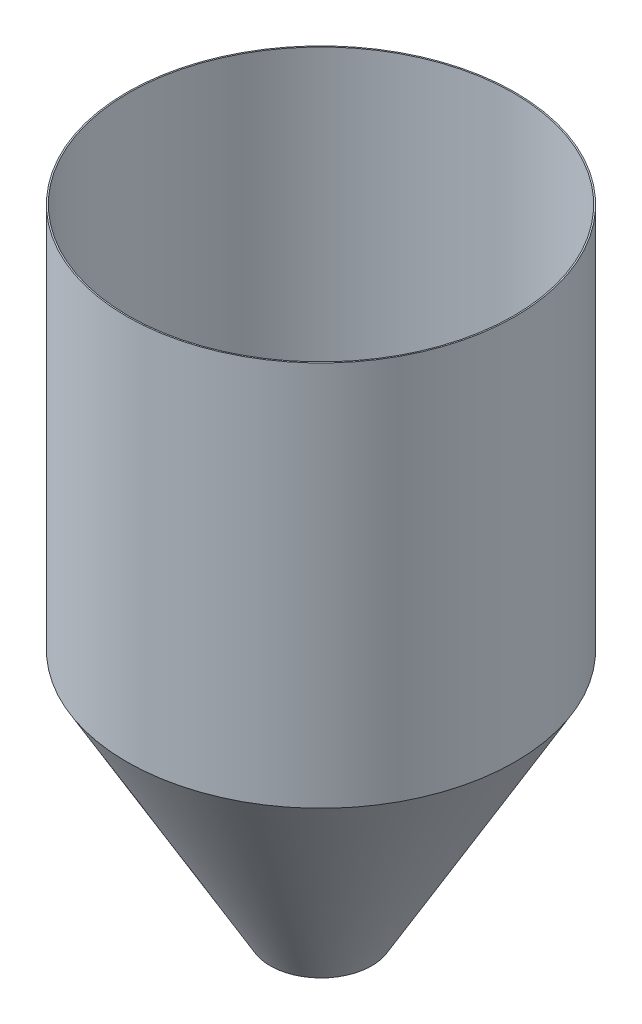
from build123d import *

# Parameters (mm, degrees)
SKETCH7_R           = 230.1875
SKETCH7_R_2         = 228.6
BOSS_EXTRUDE1_DEPTH = 457.2


with BuildPart() as part:
    # Sketch7 → Boss-Extrude1 (new body)
    with BuildSketch(Plane(origin=(0, 0, 0), x_dir=(1, 0, 0), z_dir=(0, 1, 0))):
        Circle(SKETCH7_R)
        Circle(SKETCH7_R_2, mode=Mode.SUBTRACT)
    extrude(amount=BOSS_EXTRUDE1_DEPTH)

    # Sketch8 → Revolve1 (revolve)
    with BuildSketch(Plane.XY):
        Polygon((228.6, 0), (230.1875, 0), (60.24628735, -294.34681461), (58.65878735, -294.34681461), align=None)
    revolve(axis=Axis((0, 0, 0), (0, -1, 0)))


solid = part.part
